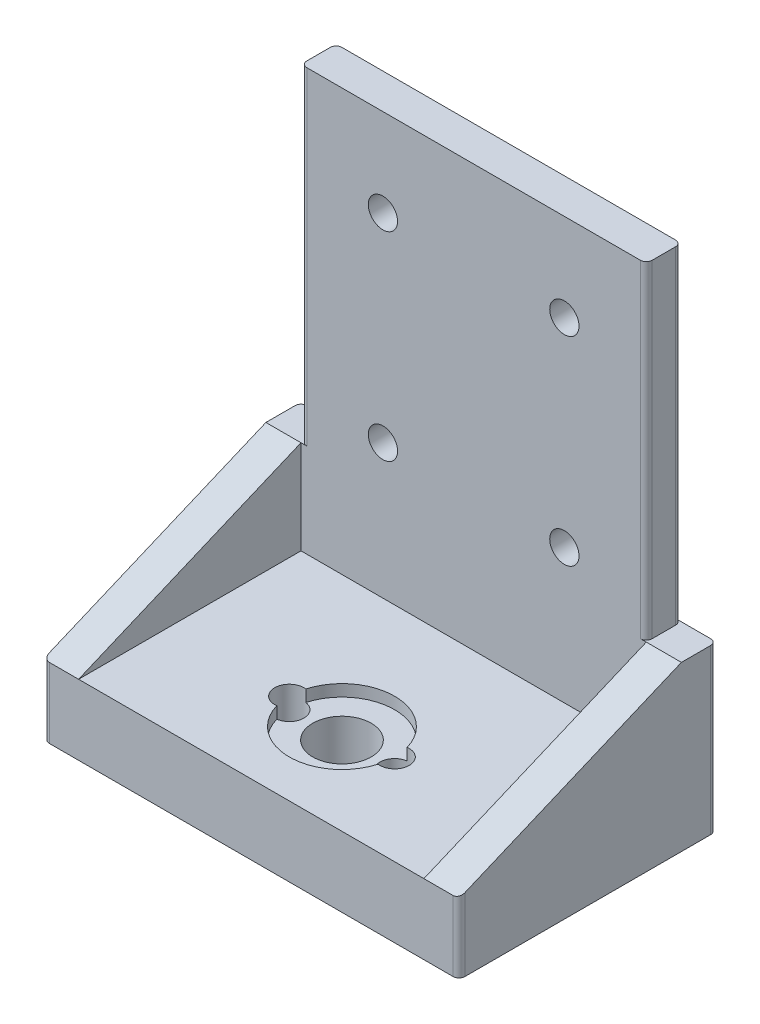
from build123d import *

# Parameters (mm, degrees)
SKETCH1_W             = 35.5
SKETCH1_H             = 22
BOSS_EXTRUDE1_DEPTH   = 42
CUT_EXTRUDE1_DEPTH    = 60.230482017
SKETCH3_W             = 3
SKETCH3_H             = 3
CUT_EXTRUDE2_DEPTH    = 28
SKETCH4_W             = 29.5
SKETCH4_H             = 10
CUT_EXTRUDE3_DEPTH    = 19
F_2_5MM_DOWEL_HOLE1_D = 2.5
F_2_5MM_DOWEL_HOLE2_D = 2.5
FILLET1_R             = 0.5


with BuildPart() as part:
    # Sketch1 → Boss-Extrude1 (new body)
    with BuildSketch(Plane(origin=(0, 0, 0), x_dir=(1, 0, 0), z_dir=(0, 1, 0))):
        with Locations((17.75, 11)):
            Rectangle(SKETCH1_W, SKETCH1_H)
    extrude(amount=BOSS_EXTRUDE1_DEPTH)

    # Sketch2 → Cut-Extrude1 (cut, through all)
    with BuildSketch(Plane(origin=(35.5, 0, 0), x_dir=(0, 0, -1), z_dir=(1, 0, 0))):
        Polygon((0, 6), (19, 14), (19, 42), (0, 42), align=None)
    extrude(amount=-CUT_EXTRUDE1_DEPTH, mode=Mode.SUBTRACT)

    # Sketch3 → Cut-Extrude2 (cut)
    with BuildSketch(Plane(origin=(0, 42, 0), x_dir=(1, 0, 0), z_dir=(0, 1, 0))):
        with Locations((1.5, 20.5)):
            Rectangle(SKETCH3_W, SKETCH3_H)
        with Locations((34, 20.5)):
            Rectangle(SKETCH3_W, SKETCH3_H)
    extrude(amount=-CUT_EXTRUDE2_DEPTH, mode=Mode.SUBTRACT)

    # Sketch4 → Cut-Extrude3 (cut)
    with BuildSketch(Plane.XY):
        with Locations((17.75, 11)):
            Rectangle(SKETCH4_W, SKETCH4_H)
    extrude(amount=-CUT_EXTRUDE3_DEPTH, mode=Mode.SUBTRACT)

    # Sketch6 → Hole1 (revolve, cut)
    with BuildSketch(Plane(origin=(17.75, 0, -7.75), x_dir=(0, 0, -1), z_dir=(1, 0, 0))):
        Polygon((0, 0), (0, 42), (4.5, 42), (4.5, 5), (2.5, 5), (2.5, 0), align=None)
    revolve(axis=Axis((17.75, 110, -7.75), (0, -1, 0)), mode=Mode.SUBTRACT)

    # Ø2.5mm Dowel Hole1 (through all)
    with Locations(Plane(origin=(0, 0, 0), x_dir=(-1, 0, 0), z_dir=(0, -1, 0))):
        with Locations((-22.25, 7.75), (-13.25, 7.75)):
            Hole(F_2_5MM_DOWEL_HOLE1_D / 2)

    # Ø2.5mm Dowel Hole2 (through all)
    with Locations(Plane(origin=(0, 0, -22), x_dir=(-1, 0, 0), z_dir=(0, 0, -1))):
        with Locations((-10, 17.5), (-25.5, 17.5), (-25.5, 34.5), (-10, 34.5)):
            Hole(F_2_5MM_DOWEL_HOLE2_D / 2)

    # Fillet1
    # the kernel refuses this fillet: 0.5 mm, written as the material it takes off along each edge
    with BuildSketch(Plane(origin=(35.5, -1.25, 0), x_dir=(-1, 0, 0), z_dir=(0, 1, 0))) as fillet1_piece_1:
        with BuildLine():
            CenterArc((FILLET1_R, -FILLET1_R), FILLET1_R, 90, 90)
            Line((0, -FILLET1_R), (0, 0))
            Line((0, 0), (FILLET1_R, 0))
        make_face()
    extrude(amount=8.5, mode=Mode.SUBTRACT)
    with BuildSketch(Plane(origin=(0, -1.25, 0), x_dir=(1, 0, 0), z_dir=(0, 1, 0))) as fillet1_piece_2:
        with BuildLine():
            CenterArc((FILLET1_R, FILLET1_R), FILLET1_R, 180, 90)
            Line((0, FILLET1_R), (0, 0))
            Line((0, 0), (FILLET1_R, 0))
        make_face()
    extrude(amount=8.5, mode=Mode.SUBTRACT)
    with BuildSketch(Plane(origin=(0, -1.25, -22), x_dir=(0, 0, 1), z_dir=(0, 1, 0))) as fillet1_piece_3:
        with BuildLine():
            CenterArc((FILLET1_R, FILLET1_R), FILLET1_R, 180, 90)
            Line((0, FILLET1_R), (0, 0))
            Line((0, 0), (FILLET1_R, 0))
        make_face()
    extrude(amount=16.5, mode=Mode.SUBTRACT)
    with BuildSketch(Plane(origin=(35.5, -1.25, -22), x_dir=(0, 0, 1), z_dir=(0, 1, 0))) as fillet1_piece_4:
        with BuildLine():
            CenterArc((FILLET1_R, -FILLET1_R), FILLET1_R, 90, 90)
            Line((0, -FILLET1_R), (0, 0))
            Line((0, 0), (FILLET1_R, 0))
        make_face()
    extrude(amount=16.5, mode=Mode.SUBTRACT)
    with BuildSketch(Plane(origin=(3, 43.25, -22), x_dir=(1, 0, 0), z_dir=(0, -1, 0))) as fillet1_piece_5:
        with BuildLine():
            CenterArc((FILLET1_R, FILLET1_R), FILLET1_R, 180, 90)
            Line((0, FILLET1_R), (0, 0))
            Line((0, 0), (FILLET1_R, 0))
        make_face()
    extrude(amount=29.25, mode=Mode.SUBTRACT)
    with BuildSketch(Plane(origin=(3, 43.25, -19), x_dir=(1, 0, 0), z_dir=(0, -1, 0)), Plane(origin=(32.5, 14, -19), x_dir=(-1, 0, 0), z_dir=(0, 1, 0)), Plane(origin=(32.5, 43.25, -22), x_dir=(-1, 0, 0), z_dir=(0, -1, 0))) as fillet1_piece_6:
        with BuildLine():
            CenterArc((FILLET1_R, -FILLET1_R), FILLET1_R, 90, 90)
            Line((0, -FILLET1_R), (0, 0))
            Line((0, 0), (FILLET1_R, 0))
        make_face()
    extrude(amount=29.25, mode=Mode.SUBTRACT)


solid = part.part
